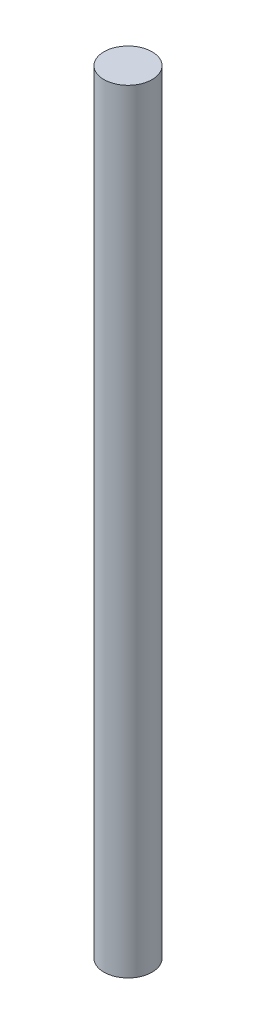
from build123d import *

# Parameters (mm, degrees)
SKETCH1_R           = 9.4996
BOSS_EXTRUDE1_DEPTH = 152.4


with BuildPart() as part:
    # Sketch1 → Boss-Extrude1 (new, symmetric)
    with BuildSketch(Plane(origin=(0, 0, 0), x_dir=(1, 0, 0), z_dir=(0, 1, 0))):
        Circle(SKETCH1_R)
    extrude(amount=BOSS_EXTRUDE1_DEPTH, both=True)


solid = part.part
